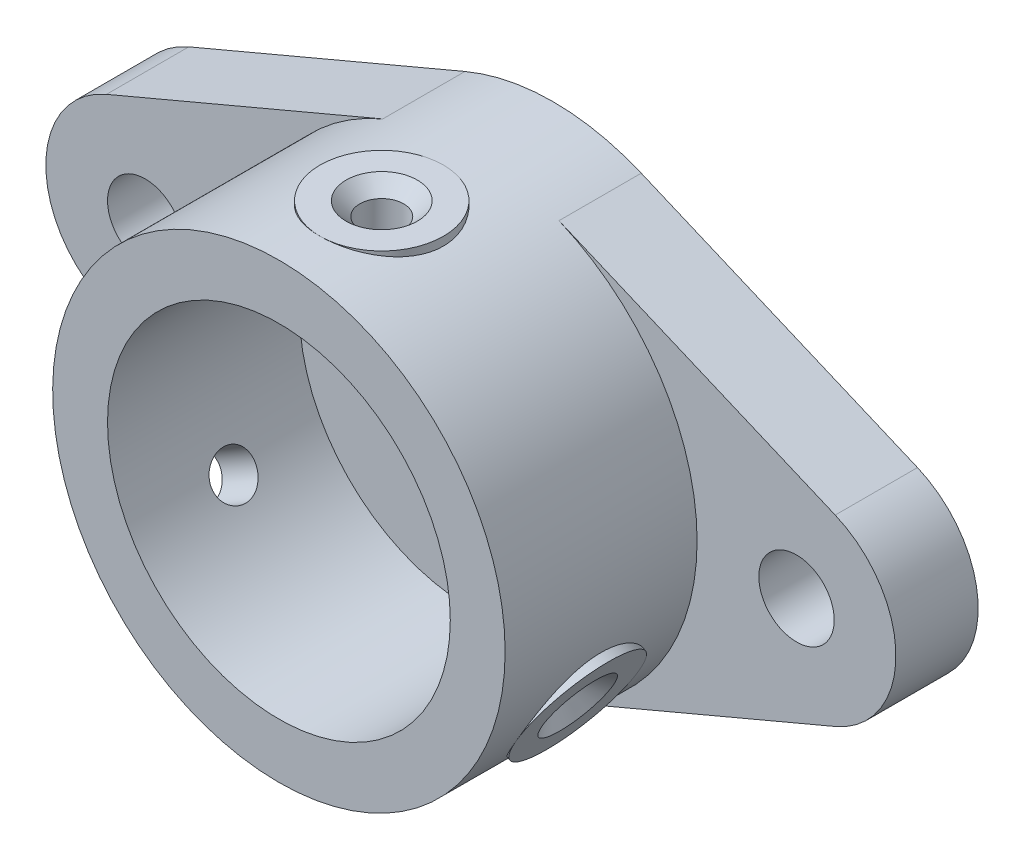
from build123d import *

# Parameters (mm, degrees)
SKETCH1_R                = 16.5
SKETCH1_R_2              = 12.5
BOSS_EXTRUDE1_DEPTH      = 15
BOSS_EXTRUDE2_START      = 5
SKETCH2_R                = 16.5
BOSS_EXTRUDE2_DEPTH      = 5
BOSS_EXTRUDE3_REACH      = 41.828
BOSS_EXTRUDE3_END_RADIUS = 16.5
SKETCH3_R                = 4.5
CUT_EXTRUDE1_REACH       = 41.828
CUT_EXTRUDE1_END_RADIUS  = 12.5
SKETCH4_R                = 1.6
CIRPATTERN1_COUNT        = 3
CHAMFER1_SIZE            = 1
SKETCH5_R                = 2.75
BOSS_EXTRUDE4_DEPTH      = 6


with BuildPart() as part:
    # Sketch1 → Boss-Extrude1 (new body)
    with BuildSketch(Plane.XY):
        Circle(SKETCH1_R)
        Circle(SKETCH1_R_2, mode=Mode.SUBTRACT)
    extrude(amount=BOSS_EXTRUDE1_DEPTH)

    # Sketch2 → Boss-Extrude2 (add)
    with BuildSketch(Plane(origin=(0, 0, 0), x_dir=(-1, 0, 0), z_dir=(0, 0, -1)).offset(BOSS_EXTRUDE2_START)):
        Circle(SKETCH2_R)
    extrude(amount=-BOSS_EXTRUDE2_DEPTH)

    # Boss-Extrude3: up to this cylinder (the profile starts outside it)
    boss_extrude3_end = Plane(origin=(0, 0, 7.5), z_dir=(0, 0, -1)) * Cylinder(BOSS_EXTRUDE3_END_RADIUS, 117.656, mode=Mode.PRIVATE)
    # Sketch3 → Boss-Extrude3 (add, up to the surface)
    with BuildSketch(Plane(origin=(0, 16.5, 0), x_dir=(1, 0, 0), z_dir=(0, 1, 0)), mode=Mode.PRIVATE) as boss_extrude3_sk1:
        with Locations((0, -7.5)):
            Circle(SKETCH3_R)
    boss_extrude3_tool1 = extrude(boss_extrude3_sk1.sketch, amount=-BOSS_EXTRUDE3_REACH, mode=Mode.PRIVATE) - boss_extrude3_end
    boss_extrude3 = boss_extrude3_tool1.solids().sort_by_distance((0, 16.5, 7.5))[0] + boss_extrude3_tool1.solids().sort_by_distance((0, 16.5, 7.5))[1]
    add(boss_extrude3)

    # Cut-Extrude1: up to this cylinder (the profile starts outside it)
    cut_extrude1_end = Plane(origin=(0, 0, 7.5), z_dir=(0, 0, -1)) * Cylinder(CUT_EXTRUDE1_END_RADIUS, 109.656, mode=Mode.PRIVATE)
    # Sketch4 → Cut-Extrude1 (cut, up to the surface)
    with BuildSketch(Plane(origin=(0, 16.5, 0), x_dir=(1, 0, 0), z_dir=(0, 1, 0)), mode=Mode.PRIVATE) as cut_extrude1_sk1:
        with Locations((0, -7.5)):
            Circle(SKETCH4_R)
    cut_extrude1_tool1 = extrude(cut_extrude1_sk1.sketch, amount=-CUT_EXTRUDE1_REACH, mode=Mode.PRIVATE) - cut_extrude1_end
    cut_extrude1 = cut_extrude1_tool1.solids().sort_by_distance((0, 16.5, 7.5))[0]
    add(cut_extrude1, mode=Mode.SUBTRACT)

    # CirPattern1: Boss-Extrude3, Cut-Extrude1 ×3 about axis
    cirpattern1_axis = Axis((0, 0, 15), (0, 0, 1))
    add([boss_extrude3.rotate(cirpattern1_axis, i * 360 / CIRPATTERN1_COUNT) for i in range(1, CIRPATTERN1_COUNT)])
    add([cut_extrude1.rotate(cirpattern1_axis, i * 360 / CIRPATTERN1_COUNT) for i in range(1, CIRPATTERN1_COUNT)], mode=Mode.SUBTRACT)

    # Chamfer1
    chamfer1_edges = [part.edges().sort_by_distance(p)[0] for p in [
        (-13.489419162, -9.635640646, 7.5),
        (15.089419162, -6.864359354, 7.5),
        (-1.6, 16.5, 7.5),
    ]]
    chamfer(chamfer1_edges, length=CHAMFER1_SIZE)

    # Sketch5 → Boss-Extrude4 (add)
    with BuildSketch(Plane(origin=(0, 0, -5), x_dir=(-1, 0, 0), z_dir=(0, 0, -1))):
        with BuildLine():
            Line((26.573684211, 6.677522556), (6.426315789, 15.197120299))
            ThreePointArc((6.426315789, 15.197120299), (0, 16.5), (-6.426315789, 15.197120299))
            Line((-6.426315789, 15.197120299), (-26.573684211, 6.677522556))
            ThreePointArc((-26.573684211, 6.677522556), (-31, 0), (-26.573684211, -6.677522556))
            Line((-26.573684211, -6.677522556), (-6.426315789, -15.197120299))
            ThreePointArc((-6.426315789, -15.197120299), (0, -16.5), (6.426315789, -15.197120299))
            Line((6.426315789, -15.197120299), (26.573684211, -6.677522556))
            ThreePointArc((26.573684211, -6.677522556), (31, 0), (26.573684211, 6.677522556))
        make_face()
        with Locations((23.75, 0)):
            Circle(SKETCH5_R, mode=Mode.SUBTRACT)
        with Locations((-23.75, 0)):
            Circle(SKETCH5_R, mode=Mode.SUBTRACT)
    extrude(amount=-BOSS_EXTRUDE4_DEPTH)


solid = part.part
